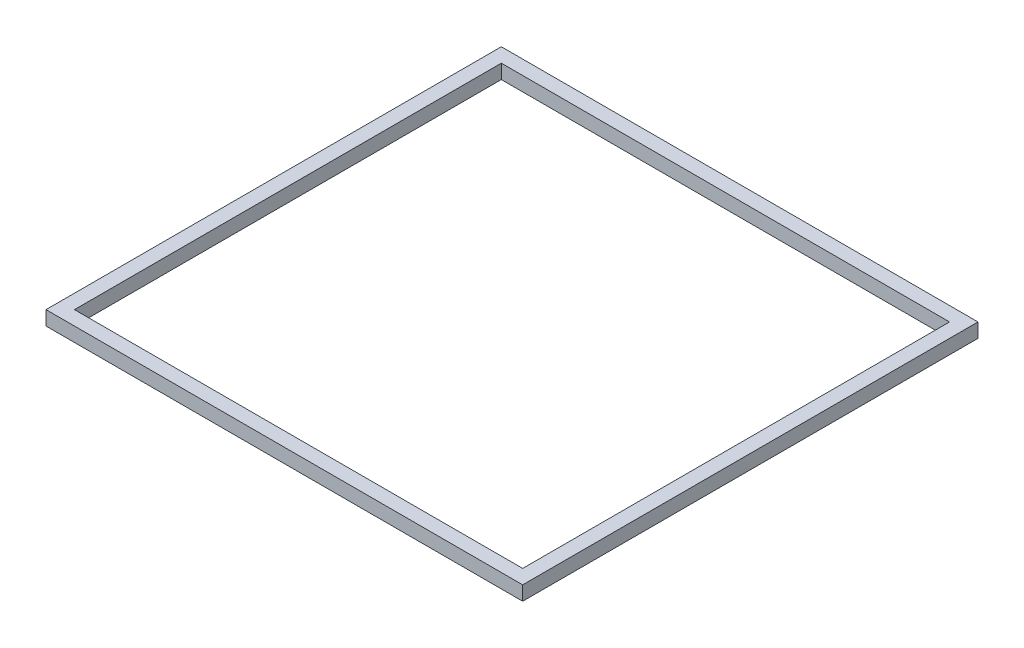
from build123d import *

# Parameters (mm, degrees)
SKETCH_1_W      = 670
SKETCH_1_H      = 640
SKETCH_1_W_2    = 630
SKETCH_1_H_2    = 600
EXTRUDE_1_DEPTH = 20


with BuildPart() as part:
    # 草图1 → 凸台-拉伸1 (new body)
    with BuildSketch(Plane(origin=(0, 0, 0), x_dir=(1, 0, 0), z_dir=(0, 1, 0))):
        with Locations((5.61212976, -172.094950635)):
            Rectangle(SKETCH_1_W, SKETCH_1_H)
        with Locations((5.61212976, -172.094950635)):
            Rectangle(SKETCH_1_W_2, SKETCH_1_H_2, mode=Mode.SUBTRACT)
    extrude(amount=EXTRUDE_1_DEPTH)


solid = part.part
